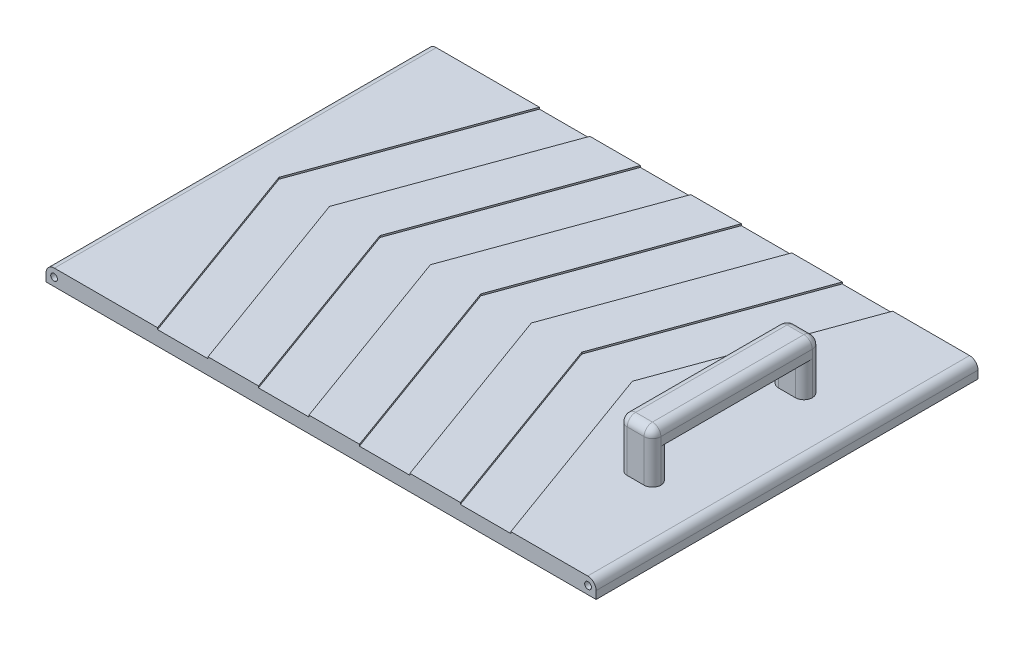
from build123d import *

# Parameters (mm, degrees)
ESBO_O1_W                = 163.5
ESBO_O1_H                = 113.5
ESBO_O1_W_2              = 160
ESBO_O1_H_2              = 110
RESSALTO_EXTRUS_O1_DEPTH = 4.8
ESBO_O2_R                = 1
CORTE_EXTRUS_O1_DEPTH    = 20
FILETE1_R                = 2.5
ESBO_O3_W                = 10
ESBO_O3_H                = 5
RESSALTO_EXTRUS_O2_DEPTH = 10
ESBO_O4_W                = 10
ESBO_O4_H                = 50
RESSALTO_EXTRUS_O3_DEPTH = 5
FILETE2_R                = 2.5
FILETE3_R                = 2.5
CORTE_EXTRUS_O2_DEPTH    = 0.5


with BuildPart() as part:
    # Esboço1 → Ressalto-extrusão1 (new body)
    # profile 1 of 2: a face of its own
    with BuildSketch(Plane(origin=(0, 0, 0), x_dir=(1, 0, 0), z_dir=(0, 1, 0))):
        Rectangle(ESBO_O1_W, ESBO_O1_H)
        Rectangle(ESBO_O1_W_2, ESBO_O1_H_2, mode=Mode.SUBTRACT)
    # profile 2 of 2: a face of its own
    with BuildSketch(Plane(origin=(0, 0, 0), x_dir=(1, 0, 0), z_dir=(0, 1, 0))):
        Rectangle(ESBO_O1_W_2, ESBO_O1_H_2)
    extrude(amount=RESSALTO_EXTRUS_O1_DEPTH)

    # Esboço2 → Corte-extrusão1 (cut)
    with BuildSketch(Plane.XY.offset(56.75)):
        with Locations((-79.35, 2.4)):
            Circle(ESBO_O2_R)
        with Locations((79.35, 2.4)):
            Circle(ESBO_O2_R)
    corte_extrus_o1 = extrude(amount=-CORTE_EXTRUS_O1_DEPTH, mode=Mode.SUBTRACT)

    # Espelhar1: Corte-extrusão1 across plane
    add(corte_extrus_o1.mirror(Plane.XY), mode=Mode.SUBTRACT)

    # Filete1
    filete1_edges = [part.edges().sort_by_distance(p)[0] for p in [
        (-81.75, 4.8, 0),
        (81.75, 4.8, 0),
    ]]
    fillet(filete1_edges, radius=FILETE1_R)

    # Esboço3 → Ressalto-extrusão2 (add)
    with BuildSketch(Plane(origin=(0, 4.8, 0), x_dir=(1, 0, 0), z_dir=(0, 1, 0))):
        with Locations((61.75, -22.5)):
            Rectangle(ESBO_O3_W, ESBO_O3_H)
        with Locations((61.75, 22.5)):
            Rectangle(ESBO_O3_W, ESBO_O3_H)
    extrude(amount=RESSALTO_EXTRUS_O2_DEPTH)

    # Esboço4 → Ressalto-extrusão3 (add)
    with BuildSketch(Plane(origin=(0, 14.8, 0), x_dir=(1, 0, 0), z_dir=(0, 1, 0))):
        with Locations((61.75, 0)):
            Rectangle(ESBO_O4_W, ESBO_O4_H)
    extrude(amount=RESSALTO_EXTRUS_O3_DEPTH)

    # Filete2
    filete2_edges = [part.edges().sort_by_distance(p)[0] for p in [
        (61.75, 19.8, -25),
        (61.75, 19.8, 25),
    ]]
    fillet(filete2_edges, radius=FILETE2_R)

    # Filete3
    filete3_edges = [part.edges().sort_by_distance(p)[0] for p in [
        (56.75, 11.05, -25),
        (56.75, 19.067766953, -24.267766953),
        (56.75, 11.05, 25),
        (56.75, 19.067766953, 24.267766953),
        (66.75, 11.05, 25),
        (66.75, 19.067766953, 24.267766953),
        (66.75, 11.05, -25),
        (66.75, 19.067766953, -24.267766953),
        (56.75, 19.8, 0),
        (66.75, 19.8, 0),
        (66.75, 9.8, 20),
        (56.75, 9.8, 20),
        (56.75, 9.8, -20),
        (66.75, 9.8, -20),
    ]]
    fillet(filete3_edges, radius=FILETE3_R - 0.0001)  # a hair under: the kernel refuses the full size

    # Esboço5 → Corte-extrusão2 (cut)
    with BuildSketch(Plane(origin=(0, 4.8, 0), x_dir=(1, 0, 0), z_dir=(0, 1, 0))):
        Polygon((-54.25, 0), (-32.411785944, 60), (-47.411785944, 60), (-69.25, 0), (-47.411785944, -60), (-32.411785944, -60), align=None)
        Polygon((-24.25, 0), (-2.411785944, -60), (-17.411785944, -60), (-39.25, 0), (-17.411785944, 60), (-2.411785944, 60), align=None)
        Polygon((5.75, 0), (27.588214056, -60), (12.588214056, -60), (-9.25, 0), (12.588214056, 60), (27.588214056, 60), align=None)
        Polygon((35.75, 0), (57.588214056, -60), (42.588214056, -60), (20.75, 0), (42.588214056, 60), (57.588214056, 60), align=None)
    extrude(amount=-CORTE_EXTRUS_O2_DEPTH, mode=Mode.SUBTRACT)


solid = part.part
